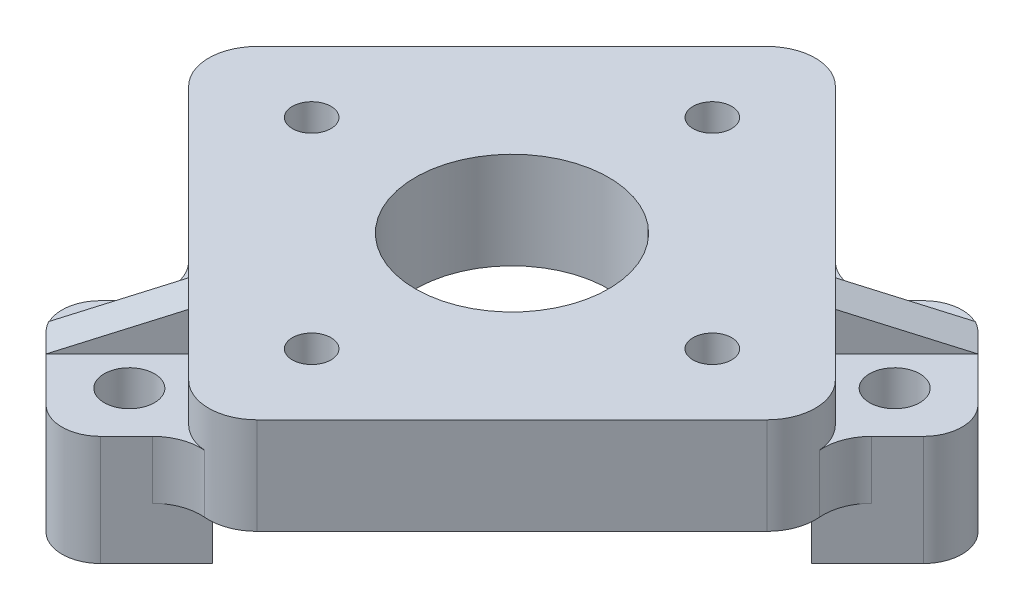
from build123d import *

# Parameters (mm, degrees)
SKETCH1_R                 = 0.5
SKETCH1_R_2               = 5
BOSS_EXTRUDE1_DEPTH       = 5
SKETCH3_R                 = 1.3
BOSS_EXTRUDE4_DEPTH       = 5.7
BOSS_EXTRUDE6_DEPTH       = 1
FILLET1_R                 = 2.5
FILLET2_R                 = 2
F_2_0MM_DOWEL_HOLE1_D     = 2
F_2_0MM_DOWEL_HOLE1_DEPTH = 42.93
F_2_0MM_DOWEL_HOLE1_TIP   = 0.600860619


with BuildPart() as part:
    # Sketch1 → Boss-Extrude1 (new body)
    with BuildSketch(Plane(origin=(0, 0, 0), x_dir=(1, 0, 0), z_dir=(0, 1, 0))):
        with BuildLine():
            Line((1.767766953, 14.961194078), (14.961194078, 1.767766953))
            ThreePointArc((14.961194078, 1.767766953), (15.693427125, 0), (14.961194078, -1.767766953))
            Line((14.961194078, -1.767766953), (1.767766953, -14.961194078))
            ThreePointArc((1.767766953, -14.961194078), (0, -15.693427125), (-1.767766953, -14.961194078))
            Line((-1.767766953, -14.961194078), (-14.961194078, -1.767766953))
            ThreePointArc((-14.961194078, -1.767766953), (-15.693427125, 0), (-14.961194078, 1.767766953))
            Line((-14.961194078, 1.767766953), (-1.767766953, 14.961194078))
            ThreePointArc((-1.767766953, 14.961194078), (0, 15.693427125), (1.767766953, 14.961194078))
        make_face()
        with Locations(Location((0, 10.365, 0), (0, 0, 270))):
            Circle(SKETCH1_R, mode=Mode.SUBTRACT)
        with Locations(Location((0, -10.365, 0), (0, 0, 270))):
            Circle(SKETCH1_R, mode=Mode.SUBTRACT)
        with Locations(Location((10.365, 0, 0), (0, 0, 270))):
            Circle(SKETCH1_R, mode=Mode.SUBTRACT)
        with Locations(Location((-10.365, 0, 0), (0, 0, 270))):
            Circle(SKETCH1_R, mode=Mode.SUBTRACT)
        with Locations(Location((0, 0, 0), (0, 0, 270))):
            Circle(SKETCH1_R_2, mode=Mode.SUBTRACT)
    extrude(amount=BOSS_EXTRUDE1_DEPTH)

    # Sketch3 → Boss-Extrude4 (add)
    # profile 1 of 4: a face of its own
    with BuildSketch(Plane(origin=(0, -2.7, 0), x_dir=(1, 0, 0), z_dir=(0, 1, 0))):
        Polygon((-4.949747468, -10.537489101), (-0.637994164, -14.849242405), (-4.949747468, -19.160995709), (-9.261500772, -14.849242405), align=None)
        with Locations(Location((-4.949747468, -14.849242405, 0), (0, 0, 90))):
            Circle(SKETCH3_R, mode=Mode.SUBTRACT)
    # profile 2 of 4: a face of its own
    with BuildSketch(Plane(origin=(0, -2.7, 0), x_dir=(1, 0, 0), z_dir=(0, 1, 0))):
        Polygon((-6.717514421, -8.769722148), (-11.029267725, -13.081475452), (-9.261500772, -14.849242405), (-4.949747468, -10.537489101), align=None)
    # profile 3 of 4: a face of its own
    with BuildSketch(Plane(origin=(0, -2.7, 0), x_dir=(1, 0, 0), z_dir=(0, 1, 0))):
        Polygon((19.160995709, 4.949747468), (14.849242405, 9.261500772), (10.537489101, 4.949747468), (14.849242405, 0.637994164), align=None)
        with Locations(Location((14.849242405, 4.949747468, 0), (0, 0, 90))):
            Circle(SKETCH3_R, mode=Mode.SUBTRACT)
    # profile 4 of 4: a face of its own
    with BuildSketch(Plane(origin=(0, -2.7, 0), x_dir=(1, 0, 0), z_dir=(0, 1, 0))):
        Polygon((13.081475452, 11.029267725), (14.849242405, 9.261500772), (10.537489101, 4.949747468), (8.769722148, 6.717514421), align=None)
    extrude(amount=BOSS_EXTRUDE4_DEPTH)


with BuildPart() as boss_extrude6_tool:
    # Sketch7 → Boss-Extrude6 (new, symmetric)
    with BuildSketch(Plane(origin=(2.707626069, -2.13e-07, 2.707626069), x_dir=(0.7071067811865474, 0, -0.7071067811865478), z_dir=(0.7071067811865467, -5.5755039757469385e-08, 0.7071067811865462))):
        Polygon((11.829161787, 5.00000052), (17.04887, 3.00000056), (11.829161787, 3.00000052), align=None)
        Polygon((-11.829161787, 5.00000052), (-17.04887, 3.00000056), (-11.829161787, 3.00000052), align=None)
    extrude(amount=BOSS_EXTRUDE6_DEPTH, both=True)


with BuildPart() as part_1:
    add(part.part)


with BuildPart() as part_2:
    # Boss-Extrude6: joined with boss_extrude6_tool
    add(part_1.part.fuse(boss_extrude6_tool.part, tol=0.00001))

    # Fillet1
    fillet1_edges = [part_2.edges().sort_by_distance(p)[0] for p in [
        (-7.338376652, 1.5, 9.390584379),
        (-1.184018869, 1.5, 15.395267109),
        (9.390584379, 1.5, -7.338376652),
        (15.395267109, 1.5, -1.184018869),
    ]]
    fillet(fillet1_edges, radius=FILLET1_R)

    # Fillet2
    # the kernel refuses this fillet: 2 mm, written as the material it takes off along each edge
    with BuildSketch(Plane(origin=(-4.949747468, -7.7, 19.160995709), x_dir=(-0.7071067811865471, 0, -0.707106781186548), z_dir=(0, 1, 0)), Plane(origin=(13.081475452, -7.7, -11.029267725), x_dir=(0.7071067811865476, 0, 0.7071067811865476), z_dir=(0, 1, 0))) as fillet2_piece_1:
        with BuildLine():
            CenterArc((FILLET2_R, -FILLET2_R), FILLET2_R, 90, 90)
            Line((0, -FILLET2_R), (0, 0))
            Line((0, 0), (FILLET2_R, 0))
        make_face()
    extrude(amount=15.7, mode=Mode.SUBTRACT)
    with BuildSketch(Plane(origin=(-11.029267725, -7.7, 13.081475452), x_dir=(0.707106781186547, 0, 0.7071067811865479), z_dir=(0, 1, 0)), Plane(origin=(19.160995709, -7.7, -4.949747468), x_dir=(-0.7071067811865482, 0, -0.7071067811865469), z_dir=(0, 1, 0))) as fillet2_piece_2:
        with BuildLine():
            CenterArc((FILLET2_R, FILLET2_R), FILLET2_R, 180, 90)
            Line((0, FILLET2_R), (0, 0))
            Line((0, 0), (FILLET2_R, 0))
        make_face()
    extrude(amount=15.7, mode=Mode.SUBTRACT)

    # Ø2.0mm Dowel Hole1
    with Locations(Plane.XZ):
        with Locations((0, 10.365), (10.365, 0), (-10.365, 0), (0, -10.365)):
            Hole(F_2_0MM_DOWEL_HOLE1_D / 2, depth=F_2_0MM_DOWEL_HOLE1_DEPTH)
            with Locations((0, 0, -(F_2_0MM_DOWEL_HOLE1_DEPTH + F_2_0MM_DOWEL_HOLE1_TIP / 2))):  # 118° drill point
                Cone(0, F_2_0MM_DOWEL_HOLE1_D / 2, F_2_0MM_DOWEL_HOLE1_TIP, mode=Mode.SUBTRACT)


solid = part_2.part
